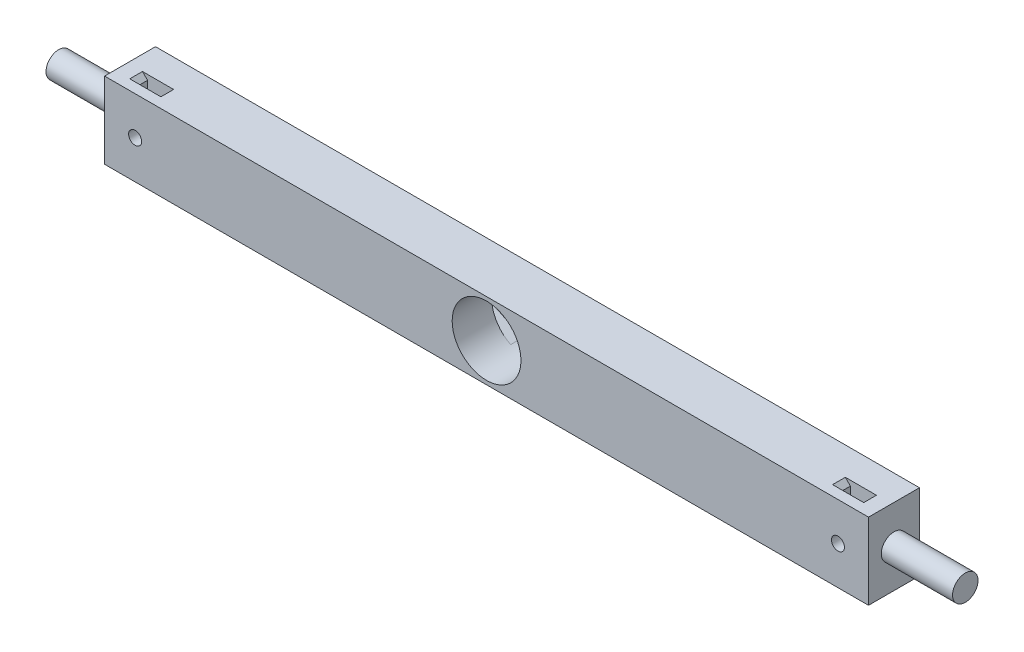
from build123d import *

# Parameters (mm, degrees)
SKETCH_1_W                 = 300
SKETCH_1_H                 = 30
EXTRUDE_1_DEPTH            = 20
SKETCH_3_R                 = 4
CUT_EXTRUDE_1_DEPTH        = 155.272486205
SKETCH_3_3_R               = 6
SKETCH_3_3_R_2             = 4
CUT_EXTRUDE_2_DEPTH        = 155.272486205
SKETCH_3_4_R               = 13.5
SKETCH_3_4_R_2             = 6
CUT_EXTRUDE_3_DEPTH        = 155.272486205
SKETCH_3_5_R               = 2.4
CUT_EXTRUDE_4_DEPTH        = 4.5
SKETCH_3_6_R               = 2.4
CUT_EXTRUDE_5_DEPTH        = 5
SKETCH_4_R                 = 5
EXTRUDE_2_DEPTH            = 28
SKETCH_5_R                 = 2.55
CUT_EXTRUDE_6_DEPTH        = 4
SKETCH_6_W                 = 8.216991224
SKETCH_6_H                 = 30
CUT_EXTRUDE_7_DEPTH        = 5
CHAMFER_1_SIZE             = 2
CHAMFER_1_OF_MIRROR_2_SIZE = 2


with BuildPart() as part:
    # 草图1 → 凸台-拉伸1 (new body)
    with BuildSketch(Plane.XY):
        with Locations((0, 15)):
            Rectangle(SKETCH_1_W, SKETCH_1_H)
    extrude(amount=EXTRUDE_1_DEPTH)

    # 草图3 → 切除-拉伸1 (cut, through all)
    with BuildSketch(Plane(origin=(0, 0, 0), x_dir=(-1, 0, 0), z_dir=(0, 0, -1))):
        with Locations((0, 15)):
            Circle(SKETCH_3_R)
    extrude(amount=-CUT_EXTRUDE_1_DEPTH, mode=Mode.SUBTRACT)

    # 草图3<3> → 切除-拉伸2 (cut, through all)
    with BuildSketch(Plane(origin=(0, 0, 0), x_dir=(-1, 0, 0), z_dir=(0, 0, -1))):
        with Locations((0, 15)):
            Circle(SKETCH_3_3_R)
        with Locations((0, 15)):
            Circle(SKETCH_3_3_R_2, mode=Mode.SUBTRACT)
    extrude(amount=-CUT_EXTRUDE_2_DEPTH, mode=Mode.SUBTRACT)

    # 草图3<4> → 切除-拉伸3 (cut, through all)
    with BuildSketch(Plane(origin=(0, 0, 0), x_dir=(-1, 0, 0), z_dir=(0, 0, -1))):
        with Locations((0, 15)):
            Circle(SKETCH_3_4_R)
        with Locations((0, 15)):
            Circle(SKETCH_3_4_R_2, mode=Mode.SUBTRACT)
    extrude(amount=-CUT_EXTRUDE_3_DEPTH, mode=Mode.SUBTRACT)

    # 草图3<5> → 切除-拉伸4 (cut)
    # profile 1 of 2: a face of its own
    with BuildSketch(Plane(origin=(0, 0, 0), x_dir=(-1, 0, 0), z_dir=(0, 0, -1))):
        with BuildLine():
            ThreePointArc((-6.02027027, 2.916691435), (-13.5, 15), (-6.02027027, 27.083308565))
            Line((-6.02027027, 27.083308565), (-20.841216216, 19.699064442))
            ThreePointArc((-20.841216216, 19.699064442), (-23.75, 15), (-20.841216216, 10.300935558))
            Line((-20.841216216, 10.300935558), (-6.02027027, 2.916691435))
        make_face()
        with Locations((-18.5, 15)):
            Circle(SKETCH_3_5_R, mode=Mode.SUBTRACT)
    # profile 2 of 2: a face of its own
    with BuildSketch(Plane(origin=(0, 0, 0), x_dir=(-1, 0, 0), z_dir=(0, 0, -1))):
        with BuildLine():
            Line((20.841216216, 19.699064442), (6.02027027, 27.083308565))
            ThreePointArc((6.02027027, 27.083308565), (13.5, 15), (6.02027027, 2.916691435))
            Line((6.02027027, 2.916691435), (20.841216216, 10.300935558))
            ThreePointArc((20.841216216, 10.300935558), (23.75, 15), (20.841216216, 19.699064442))
        make_face()
        with Locations((18.5, 15)):
            Circle(SKETCH_3_5_R, mode=Mode.SUBTRACT)
    extrude(amount=-CUT_EXTRUDE_4_DEPTH, mode=Mode.SUBTRACT)

    # 草图3<6> → 切除-拉伸5 (cut)
    with BuildSketch(Plane(origin=(0, 0, 0), x_dir=(-1, 0, 0), z_dir=(0, 0, -1))):
        with Locations((18.5, 15)):
            Circle(SKETCH_3_6_R)
        with Locations((-18.5, 15)):
            Circle(SKETCH_3_6_R)
    extrude(amount=-CUT_EXTRUDE_5_DEPTH, mode=Mode.SUBTRACT)

    # 草图4 → 凸台-拉伸2 (add)
    with BuildSketch(Plane.ZY.offset(150)):
        with Locations((10, 15)):
            Circle(SKETCH_4_R)
    extrude_2 = extrude(amount=EXTRUDE_2_DEPTH)

    # 镜向1: 凸台-拉伸2 across plane
    add(extrude_2.mirror(Plane.ZY))

    # 草图5 → 切除-拉伸6 (cut)
    with BuildSketch(Plane.XY.offset(20)):
        with Locations((-138, 15)):
            Circle(SKETCH_5_R)
    cut_extrude_6 = extrude(amount=-CUT_EXTRUDE_6_DEPTH, mode=Mode.SUBTRACT)

    # 草图6 → 切除-拉伸7 (cut)
    with BuildSketch(Plane.XY.offset(16)):
        with Locations((-138, 15)):
            Rectangle(SKETCH_6_W, SKETCH_6_H)
    cut_extrude_7 = extrude(amount=-CUT_EXTRUDE_7_DEPTH, mode=Mode.SUBTRACT)

    # 倒角1
    chamfer_1_edges = [part.edges().sort_by_distance(p)[0] for p in [
        (-133.891504388, 0, 13.5),
        (-142.108495612, 0, 13.5),
        (-133.891504388, 30, 13.5),
        (-142.108495612, 30, 13.5),
    ]]
    chamfer(chamfer_1_edges, length=CHAMFER_1_SIZE)

    # 镜向2: 切除-拉伸6, 切除-拉伸7 across plane
    add(cut_extrude_6.mirror(Plane.ZY), mode=Mode.SUBTRACT)
    add(cut_extrude_7.mirror(Plane.ZY), mode=Mode.SUBTRACT)

    # 倒角1 of 镜向2
    chamfer_1_of_mirror_2_edges = [part.edges().sort_by_distance(p)[0] for p in [
        (133.891504388, 0, 13.5),
        (142.108495612, 0, 13.5),
        (133.891504388, 30, 13.5),
        (142.108495612, 30, 13.5),
    ]]
    chamfer(chamfer_1_of_mirror_2_edges, length=CHAMFER_1_OF_MIRROR_2_SIZE)


solid = part.part
